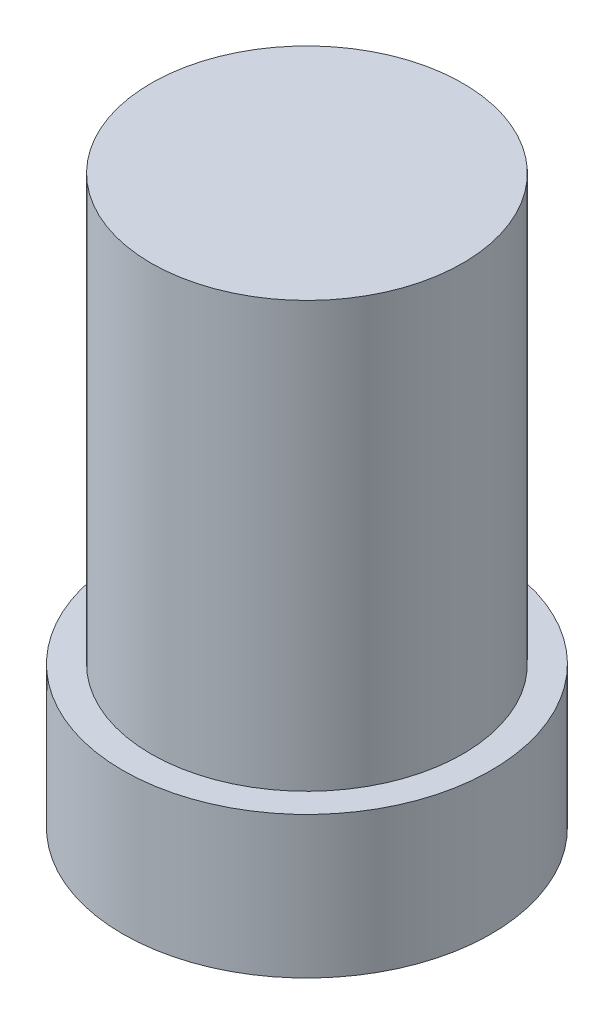
from build123d import *

# Parameters (mm, degrees)
SKETCH1_R           = 6.5
BOSS_EXTRUDE1_DEPTH = 5
SKETCH2_R           = 5.5
BOSS_EXTRUDE2_DEPTH = 15
SKETCH3_R           = 6
CUT_EXTRUDE1_DEPTH  = 4


with BuildPart() as part:
    # Sketch1 → Boss-Extrude1 (new body)
    with BuildSketch(Plane(origin=(0, 0, 0), x_dir=(1, 0, 0), z_dir=(0, 1, 0))):
        Circle(SKETCH1_R)
    extrude(amount=BOSS_EXTRUDE1_DEPTH)

    # Sketch2 → Boss-Extrude2 (add)
    with BuildSketch(Plane(origin=(0, 5, 0), x_dir=(1, 0, 0), z_dir=(0, 1, 0))):
        Circle(SKETCH2_R)
    extrude(amount=BOSS_EXTRUDE2_DEPTH)

    # Sketch3 → Cut-Extrude1 (cut)
    with BuildSketch(Plane.XZ):
        Circle(SKETCH3_R)
    extrude(amount=-CUT_EXTRUDE1_DEPTH, mode=Mode.SUBTRACT)


solid = part.part
